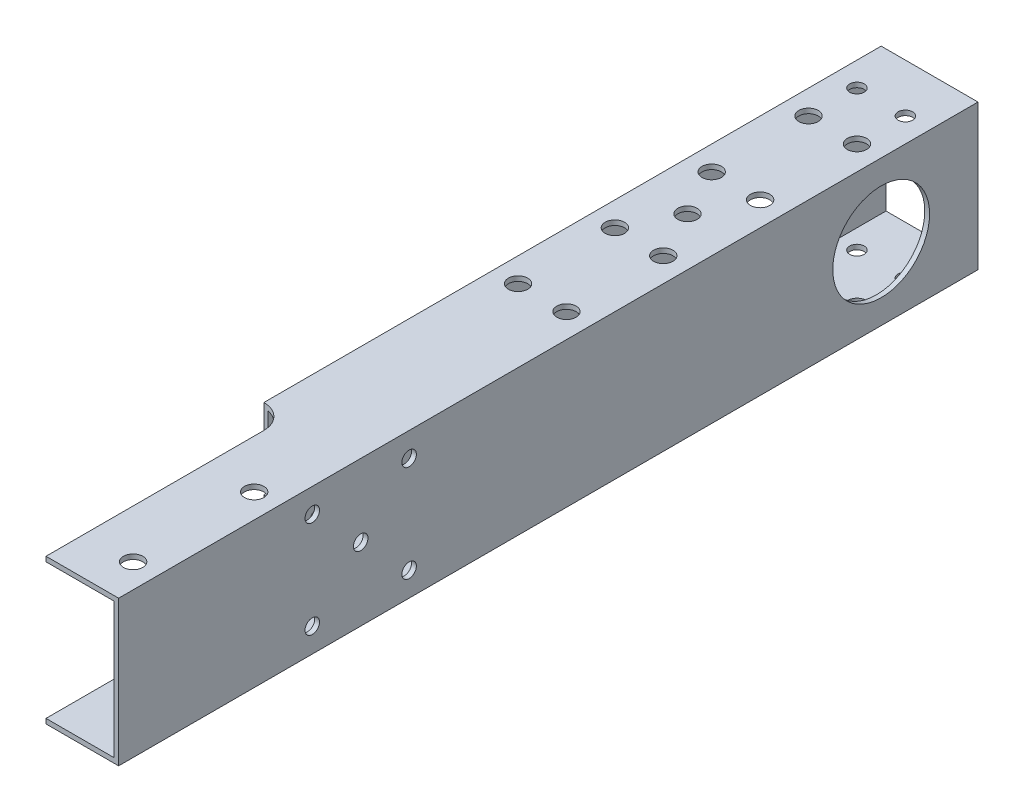
from build123d import *

# Parameters (mm, degrees)
SKETCH_1_W          = 20
SKETCH_1_H          = 30
SKETCH_1_W_2        = 18
SKETCH_1_H_2        = 28
EXTRUDE_1_DEPTH     = 177.5
CUT_EXTRUDE_1_REACH = 182.295
SKETCH_2_R          = 1.5
CUT_EXTRUDE_2_REACH = 182.295
SKETCH_3_W          = 5
SKETCH_3_H          = 50
FILLET_1_R          = 5
CUT_EXTRUDE_3_REACH = 182.295
SKETCH_4_R          = 2
CUT_EXTRUDE_4_REACH = 182.295
SKETCH_5_R          = 2
CUT_EXTRUDE_5_REACH = 181.252
SKETCH_6_R          = 1.5
SKETCH_6_R_2        = 10


with BuildPart() as part:
    # 草图1 → 拉伸-薄壁1 (new body)
    with BuildSketch(Plane.XY):
        Rectangle(SKETCH_1_W, SKETCH_1_H)
        Rectangle(SKETCH_1_W_2, SKETCH_1_H_2, mode=Mode.SUBTRACT)
    extrude(amount=EXTRUDE_1_DEPTH)

    # 切除-拉伸1: up to this face of the body (flat: up to its plane)
    cut_extrude_1_end = Plane(part.part.faces().sort_by_distance((0, -15, 88.75))[0])
    # 草图2 → 切除-拉伸1 (cut, up to the picked face)
    with BuildSketch(Plane(origin=(0, 15, 0), x_dir=(1, 0, 0), z_dir=(0, 1, 0)), mode=Mode.PRIVATE) as cut_extrude_1_sk1:
        with Locations(Location((5, -10, 0), (0, 0, 270))):
            Circle(SKETCH_2_R)
    cut_extrude_1_tool1 = split(extrude(cut_extrude_1_sk1.sketch, amount=-CUT_EXTRUDE_1_REACH, mode=Mode.PRIVATE), bisect_by=cut_extrude_1_end, keep=Keep.BOTH, mode=Mode.PRIVATE)
    # 草图2 → 切除-拉伸1 (cut, up to the picked face)
    with BuildSketch(Plane(origin=(0, 15, 0), x_dir=(1, 0, 0), z_dir=(0, 1, 0)), mode=Mode.PRIVATE) as cut_extrude_1_sk2:
        with Locations(Location((-5, -10, 0), (0, 0, 270))):
            Circle(SKETCH_2_R)
    cut_extrude_1_tool2 = split(extrude(cut_extrude_1_sk2.sketch, amount=-CUT_EXTRUDE_1_REACH, mode=Mode.PRIVATE), bisect_by=cut_extrude_1_end, keep=Keep.BOTH, mode=Mode.PRIVATE)
    add(cut_extrude_1_tool1.solids().sort_by(Axis((5, 15, 10), (0, -1, 0)))[0], mode=Mode.SUBTRACT)
    add(cut_extrude_1_tool2.solids().sort_by(Axis((-5, 15, 10), (0, -1, 0)))[0], mode=Mode.SUBTRACT)

    # 切除-拉伸2: up to this face of the body (flat: up to its plane)
    cut_extrude_2_end = Plane(part.part.faces().sort_by_distance((0, -15, 89.064860035))[0])
    # 草图3 → 切除-拉伸2 (cut, up to the picked face)
    with BuildSketch(Plane(origin=(0, 15, 0), x_dir=(1, 0, 0), z_dir=(0, 1, 0)), mode=Mode.PRIVATE) as cut_extrude_2_sk1:
        with Locations((-7.5, -152.5)):
            Rectangle(SKETCH_3_W, SKETCH_3_H)
    cut_extrude_2_tool1 = split(extrude(cut_extrude_2_sk1.sketch, amount=-CUT_EXTRUDE_2_REACH, mode=Mode.PRIVATE), bisect_by=cut_extrude_2_end, keep=Keep.BOTH, mode=Mode.PRIVATE)
    add(cut_extrude_2_tool1.solids().sort_by(Axis((-7.5, 15, 152.5), (0, -1, 0)))[0], mode=Mode.SUBTRACT)

    # 圆角1
    fillet_1_edges = [part.edges().sort_by_distance(p)[0] for p in [
        (-5, 14.5, 127.5),
    ]]
    fillet(fillet_1_edges, radius=FILLET_1_R - 0.0001)  # a hair under: the kernel refuses the full size

    # 切除-拉伸3: up to this face of the body (flat: up to its plane)
    cut_extrude_3_end = Plane(part.part.faces().sort_by_distance((0.559725578, -15, 84.310829926))[0])
    # 草图4 → 切除-拉伸3 (cut, up to the picked face)
    with BuildSketch(Plane(origin=(0, 15, 0), x_dir=(1, 0, 0), z_dir=(0, 1, 0)), mode=Mode.PRIVATE) as cut_extrude_3_sk1:
        with Locations(Location((5, -144.5, 0), (0, 0, 270))):
            Circle(SKETCH_4_R)
    cut_extrude_3_tool1 = split(extrude(cut_extrude_3_sk1.sketch, amount=-CUT_EXTRUDE_3_REACH, mode=Mode.PRIVATE), bisect_by=cut_extrude_3_end, keep=Keep.BOTH, mode=Mode.PRIVATE)
    # 草图4 → 切除-拉伸3 (cut, up to the picked face)
    with BuildSketch(Plane(origin=(0, 15, 0), x_dir=(1, 0, 0), z_dir=(0, 1, 0)), mode=Mode.PRIVATE) as cut_extrude_3_sk2:
        with Locations(Location((5, -169.5, 0), (0, 0, 270))):
            Circle(SKETCH_4_R)
    cut_extrude_3_tool2 = split(extrude(cut_extrude_3_sk2.sketch, amount=-CUT_EXTRUDE_3_REACH, mode=Mode.PRIVATE), bisect_by=cut_extrude_3_end, keep=Keep.BOTH, mode=Mode.PRIVATE)
    add(cut_extrude_3_tool1.solids().sort_by(Axis((5, 15, 144.5), (0, -1, 0)))[0], mode=Mode.SUBTRACT)
    add(cut_extrude_3_tool2.solids().sort_by(Axis((5, 15, 169.5), (0, -1, 0)))[0], mode=Mode.SUBTRACT)

    # 切除-拉伸4: up to this face of the body (flat: up to its plane)
    cut_extrude_4_end = Plane(part.part.faces().sort_by_distance((0.525557475, 15, 83.751483629))[0])
    # 草图5 → 切除-拉伸4 (cut, up to the picked face)
    with BuildSketch(Plane.XZ.offset(15), mode=Mode.PRIVATE) as cut_extrude_4_sk1:
        with Locations(Location((5, 20, 0), (0, 0, 270))):
            Circle(SKETCH_5_R)
    cut_extrude_4_tool1 = split(extrude(cut_extrude_4_sk1.sketch, amount=-CUT_EXTRUDE_4_REACH, mode=Mode.PRIVATE), bisect_by=cut_extrude_4_end, keep=Keep.BOTH, mode=Mode.PRIVATE)
    # 草图5 → 切除-拉伸4 (cut, up to the picked face)
    with BuildSketch(Plane.XZ.offset(15), mode=Mode.PRIVATE) as cut_extrude_4_sk2:
        with Locations(Location((5, 40, 0), (0, 0, 270))):
            Circle(SKETCH_5_R)
    cut_extrude_4_tool2 = split(extrude(cut_extrude_4_sk2.sketch, amount=-CUT_EXTRUDE_4_REACH, mode=Mode.PRIVATE), bisect_by=cut_extrude_4_end, keep=Keep.BOTH, mode=Mode.PRIVATE)
    # 草图5 → 切除-拉伸4 (cut, up to the picked face)
    with BuildSketch(Plane.XZ.offset(15), mode=Mode.PRIVATE) as cut_extrude_4_sk3:
        with Locations(Location((5, 60, 0), (0, 0, 270))):
            Circle(SKETCH_5_R)
    cut_extrude_4_tool3 = split(extrude(cut_extrude_4_sk3.sketch, amount=-CUT_EXTRUDE_4_REACH, mode=Mode.PRIVATE), bisect_by=cut_extrude_4_end, keep=Keep.BOTH, mode=Mode.PRIVATE)
    # 草图5 → 切除-拉伸4 (cut, up to the picked face)
    with BuildSketch(Plane.XZ.offset(15), mode=Mode.PRIVATE) as cut_extrude_4_sk4:
        with Locations(Location((5, 80, 0), (0, 0, 270))):
            Circle(SKETCH_5_R)
    cut_extrude_4_tool4 = split(extrude(cut_extrude_4_sk4.sketch, amount=-CUT_EXTRUDE_4_REACH, mode=Mode.PRIVATE), bisect_by=cut_extrude_4_end, keep=Keep.BOTH, mode=Mode.PRIVATE)
    # 草图5 → 切除-拉伸4 (cut, up to the picked face)
    with BuildSketch(Plane.XZ.offset(15), mode=Mode.PRIVATE) as cut_extrude_4_sk5:
        with Locations(Location((-5, 80, 0), (0, 0, 270))):
            Circle(SKETCH_5_R)
    cut_extrude_4_tool5 = split(extrude(cut_extrude_4_sk5.sketch, amount=-CUT_EXTRUDE_4_REACH, mode=Mode.PRIVATE), bisect_by=cut_extrude_4_end, keep=Keep.BOTH, mode=Mode.PRIVATE)
    # 草图5 → 切除-拉伸4 (cut, up to the picked face)
    with BuildSketch(Plane.XZ.offset(15), mode=Mode.PRIVATE) as cut_extrude_4_sk6:
        with Locations(Location((-5, 60, 0), (0, 0, 270))):
            Circle(SKETCH_5_R)
    cut_extrude_4_tool6 = split(extrude(cut_extrude_4_sk6.sketch, amount=-CUT_EXTRUDE_4_REACH, mode=Mode.PRIVATE), bisect_by=cut_extrude_4_end, keep=Keep.BOTH, mode=Mode.PRIVATE)
    # 草图5 → 切除-拉伸4 (cut, up to the picked face)
    with BuildSketch(Plane.XZ.offset(15), mode=Mode.PRIVATE) as cut_extrude_4_sk7:
        with Locations(Location((-5, 40, 0), (0, 0, 270))):
            Circle(SKETCH_5_R)
    cut_extrude_4_tool7 = split(extrude(cut_extrude_4_sk7.sketch, amount=-CUT_EXTRUDE_4_REACH, mode=Mode.PRIVATE), bisect_by=cut_extrude_4_end, keep=Keep.BOTH, mode=Mode.PRIVATE)
    # 草图5 → 切除-拉伸4 (cut, up to the picked face)
    with BuildSketch(Plane.XZ.offset(15), mode=Mode.PRIVATE) as cut_extrude_4_sk8:
        with Locations(Location((-5, 20, 0), (0, 0, 270))):
            Circle(SKETCH_5_R)
    cut_extrude_4_tool8 = split(extrude(cut_extrude_4_sk8.sketch, amount=-CUT_EXTRUDE_4_REACH, mode=Mode.PRIVATE), bisect_by=cut_extrude_4_end, keep=Keep.BOTH, mode=Mode.PRIVATE)
    # 草图5 → 切除-拉伸4 (cut, up to the picked face)
    with BuildSketch(Plane.XZ.offset(15), mode=Mode.PRIVATE) as cut_extrude_4_sk9:
        with Locations(Location((0, 50, 0), (0, 0, 270))):
            Circle(SKETCH_5_R)
    cut_extrude_4_tool9 = split(extrude(cut_extrude_4_sk9.sketch, amount=-CUT_EXTRUDE_4_REACH, mode=Mode.PRIVATE), bisect_by=cut_extrude_4_end, keep=Keep.BOTH, mode=Mode.PRIVATE)
    add(cut_extrude_4_tool1.solids().sort_by(Axis((5, -15, 20), (0, 1, 0)))[0], mode=Mode.SUBTRACT)
    add(cut_extrude_4_tool2.solids().sort_by(Axis((5, -15, 40), (0, 1, 0)))[0], mode=Mode.SUBTRACT)
    add(cut_extrude_4_tool3.solids().sort_by(Axis((5, -15, 60), (0, 1, 0)))[0], mode=Mode.SUBTRACT)
    add(cut_extrude_4_tool4.solids().sort_by(Axis((5, -15, 80), (0, 1, 0)))[0], mode=Mode.SUBTRACT)
    add(cut_extrude_4_tool5.solids().sort_by(Axis((-5, -15, 80), (0, 1, 0)))[0], mode=Mode.SUBTRACT)
    add(cut_extrude_4_tool6.solids().sort_by(Axis((-5, -15, 60), (0, 1, 0)))[0], mode=Mode.SUBTRACT)
    add(cut_extrude_4_tool7.solids().sort_by(Axis((-5, -15, 40), (0, 1, 0)))[0], mode=Mode.SUBTRACT)
    add(cut_extrude_4_tool8.solids().sort_by(Axis((-5, -15, 20), (0, 1, 0)))[0], mode=Mode.SUBTRACT)
    add(cut_extrude_4_tool9.solids().sort_by(Axis((0, -15, 50), (0, 1, 0)))[0], mode=Mode.SUBTRACT)

    # 切除-拉伸5: up to this face of the body (flat: up to its plane)
    cut_extrude_5_end = Plane(part.part.faces().sort_by_distance((-10, 0, 63.75))[0])
    # 草图6 → 切除-拉伸5 (cut, up to the picked face)
    with BuildSketch(Plane(origin=(10, 0, 0), x_dir=(0, 0, -1), z_dir=(1, 0, 0)), mode=Mode.PRIVATE) as cut_extrude_5_sk1:
        with Locations((-127.5, 0)):
            Circle(SKETCH_6_R)
    cut_extrude_5_tool1 = split(extrude(cut_extrude_5_sk1.sketch, amount=-CUT_EXTRUDE_5_REACH, mode=Mode.PRIVATE), bisect_by=cut_extrude_5_end, keep=Keep.BOTH, mode=Mode.PRIVATE)
    # 草图6 → 切除-拉伸5 (cut, up to the picked face)
    with BuildSketch(Plane(origin=(10, 0, 0), x_dir=(0, 0, -1), z_dir=(1, 0, 0)), mode=Mode.PRIVATE) as cut_extrude_5_sk2:
        with Locations((-117.5, 10)):
            Circle(SKETCH_6_R)
    cut_extrude_5_tool2 = split(extrude(cut_extrude_5_sk2.sketch, amount=-CUT_EXTRUDE_5_REACH, mode=Mode.PRIVATE), bisect_by=cut_extrude_5_end, keep=Keep.BOTH, mode=Mode.PRIVATE)
    # 草图6 → 切除-拉伸5 (cut, up to the picked face)
    with BuildSketch(Plane(origin=(10, 0, 0), x_dir=(0, 0, -1), z_dir=(1, 0, 0)), mode=Mode.PRIVATE) as cut_extrude_5_sk3:
        with Locations((-117.5, -10)):
            Circle(SKETCH_6_R)
    cut_extrude_5_tool3 = split(extrude(cut_extrude_5_sk3.sketch, amount=-CUT_EXTRUDE_5_REACH, mode=Mode.PRIVATE), bisect_by=cut_extrude_5_end, keep=Keep.BOTH, mode=Mode.PRIVATE)
    # 草图6 → 切除-拉伸5 (cut, up to the picked face)
    with BuildSketch(Plane(origin=(10, 0, 0), x_dir=(0, 0, -1), z_dir=(1, 0, 0)), mode=Mode.PRIVATE) as cut_extrude_5_sk4:
        with Locations((-137.5, -10)):
            Circle(SKETCH_6_R)
    cut_extrude_5_tool4 = split(extrude(cut_extrude_5_sk4.sketch, amount=-CUT_EXTRUDE_5_REACH, mode=Mode.PRIVATE), bisect_by=cut_extrude_5_end, keep=Keep.BOTH, mode=Mode.PRIVATE)
    # 草图6 → 切除-拉伸5 (cut, up to the picked face)
    with BuildSketch(Plane(origin=(10, 0, 0), x_dir=(0, 0, -1), z_dir=(1, 0, 0)), mode=Mode.PRIVATE) as cut_extrude_5_sk5:
        with Locations((-137.5, 10)):
            Circle(SKETCH_6_R)
    cut_extrude_5_tool5 = split(extrude(cut_extrude_5_sk5.sketch, amount=-CUT_EXTRUDE_5_REACH, mode=Mode.PRIVATE), bisect_by=cut_extrude_5_end, keep=Keep.BOTH, mode=Mode.PRIVATE)
    # 草图6 → 切除-拉伸5 (cut, up to the picked face)
    with BuildSketch(Plane(origin=(10, 0, 0), x_dir=(0, 0, -1), z_dir=(1, 0, 0)), mode=Mode.PRIVATE) as cut_extrude_5_sk6:
        with Locations((-20, 0)):
            Circle(SKETCH_6_R_2)
    cut_extrude_5_tool6 = split(extrude(cut_extrude_5_sk6.sketch, amount=-CUT_EXTRUDE_5_REACH, mode=Mode.PRIVATE), bisect_by=cut_extrude_5_end, keep=Keep.BOTH, mode=Mode.PRIVATE)
    add(cut_extrude_5_tool1.solids().sort_by(Axis((10, 0, 127.5), (-1, 0, 0)))[0], mode=Mode.SUBTRACT)
    add(cut_extrude_5_tool2.solids().sort_by(Axis((10, 10, 117.5), (-1, 0, 0)))[0], mode=Mode.SUBTRACT)
    add(cut_extrude_5_tool3.solids().sort_by(Axis((10, -10, 117.5), (-1, 0, 0)))[0], mode=Mode.SUBTRACT)
    add(cut_extrude_5_tool4.solids().sort_by(Axis((10, -10, 137.5), (-1, 0, 0)))[0], mode=Mode.SUBTRACT)
    add(cut_extrude_5_tool5.solids().sort_by(Axis((10, 10, 137.5), (-1, 0, 0)))[0], mode=Mode.SUBTRACT)
    add(cut_extrude_5_tool6.solids().sort_by(Axis((10, 0, 20), (-1, 0, 0)))[0], mode=Mode.SUBTRACT)


solid = part.part
